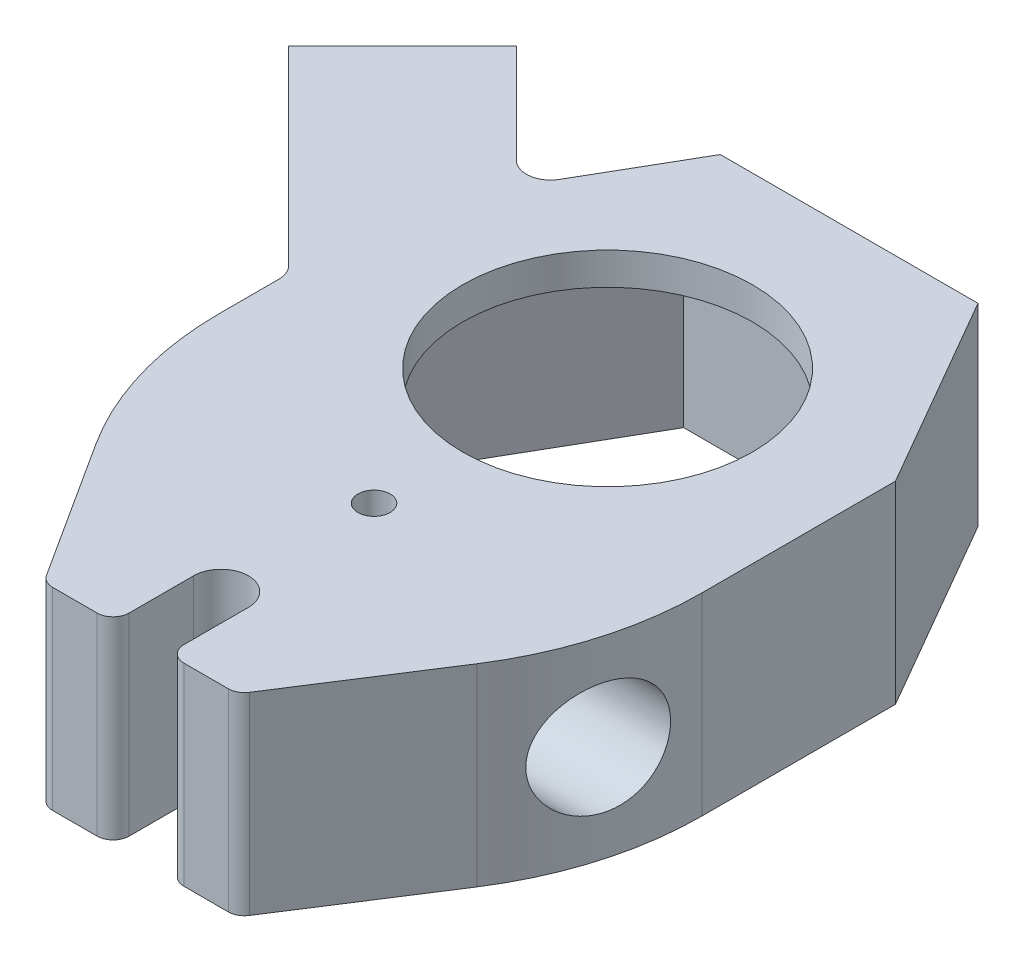
from build123d import *

# Parameters (mm, degrees)
SKETCH1_W           = 30
SKETCH1_H           = 30
BOSS_EXTRUDE1_DEPTH = 12
BOSS_EXTRUDE6_DEPTH = 12
CHAMFER1_SIZE       = 7
CHAMFER1_SIZE2      = 12.124355653
BOSS_EXTRUDE4_DEPTH = 12
SKETCH7_R           = 2.8
CUT_EXTRUDE2_DEPTH  = 15
CHAMFER2_SIZE       = 9
CHAMFER2_SIZE_2     = 14
CHAMFER3_SIZE       = 14
CHAMFER3_SIZE_2     = 9
FILLET2_R           = 20
FILLET3_R           = 1
FILLET4_R           = 1.5
SKETCH10_R          = 1
CUT_EXTRUDE3_DEPTH  = 42.546660516
SKETCH11_R          = 2
CUT_EXTRUDE4_DEPTH  = 42.546660516
SKETCH12_R          = 9
BOSS_EXTRUDE8_DEPTH = 2
SKETCH13_R          = 3.5
CUT_EXTRUDE5_DEPTH  = 8


with BuildPart() as part:
    # Sketch1 → Boss-Extrude1 (new body)
    with BuildSketch(Plane(origin=(0, 0, 0), x_dir=(1, 0, 0), z_dir=(0, 1, 0))):
        Rectangle(SKETCH1_W, SKETCH1_H)
        Polygon((6.452466608, -11.176), (12.904933217, 0), (6.452466608, 11.176), (-6.452466608, 11.176), (-12.904933217, 0), (-6.452466608, -11.176), align=None, mode=Mode.SUBTRACT)
    extrude(amount=BOSS_EXTRUDE1_DEPTH)

    # Sketch8 → Boss-Extrude6 (add)
    with BuildSketch(Plane(origin=(0, 0, 0), x_dir=(1, 0, 0), z_dir=(0, 1, 0))):
        with BuildLine():
            Line((-6, -15), (6, -15))
            Line((6, -15), (6, -29))
            Line((6, -29), (1.7, -29))
            Line((1.7, -29), (1.7, -24))
            ThreePointArc((1.7, -24), (0, -22.3), (-1.7, -24))
            Line((-1.7, -24), (-1.7, -29))
            Line((-1.7, -29), (-6, -29))
            Line((-6, -29), (-6, -15))
        make_face()
    extrude(amount=BOSS_EXTRUDE6_DEPTH)

    # Chamfer1
    chamfer1_edges = [part.edges().sort_by_distance(p)[0] for p in [
        (-15, 6, -15),
        (15, 6, -15),
    ]]
    chamfer1_side = [part.faces().sort_by_distance(p)[0] for p in [
        (0, 6, -15),
    ]]
    chamfer(chamfer1_edges, length=CHAMFER1_SIZE, length2=CHAMFER1_SIZE2, reference=chamfer1_side[0])

    # Sketch6 → Boss-Extrude4 (add)
    with BuildSketch(Plane(origin=(0, 0, 0), x_dir=(1, 0, 0), z_dir=(0, 1, 0))):
        Polygon((-27.223611076, 7.424621202), (-15, -4.798989873), (-15, 2.875644347), (-12.632730187, 6.975875938), (-20.152543264, 14.495689014), align=None)
    extrude(amount=BOSS_EXTRUDE4_DEPTH)

    # Sketch7 → Cut-Extrude2 (cut)
    with BuildSketch(Plane(origin=(-9.899494937, 0, 9.899494937), x_dir=(0.7071067811865438, 0, 0.7071067811865512), z_dir=(-0.7071067811865512, 0, 0.7071067811865438))):
        with Locations((-19.5, 6)):
            Circle(SKETCH7_R)
    extrude(amount=-CUT_EXTRUDE2_DEPTH, mode=Mode.SUBTRACT)

    # Chamfer2
    # the kernel refuses this chamfer: 14, 9 mm, written as the material it adds along each edge
    with BuildSketch(Plane(origin=(6, 0, 15), x_dir=(0.9987204462012896, 0, -0.05057143798130468), z_dir=(0, 1, 0))) as chamfer2_piece_1:
        Polygon((CHAMFER2_SIZE * 0.998720446201, -CHAMFER2_SIZE * 0.0505714379813), (-CHAMFER2_SIZE_2 * 0.0505714379813, -CHAMFER2_SIZE_2 * 0.998720446201), (0, 0), align=None)
    extrude(amount=12)

    # Chamfer3
    # the kernel refuses this chamfer: 14, 9 mm, written as the material it adds along each edge
    with BuildSketch(Plane(origin=(-6, 0, 15), x_dir=(0.020921616646829202, 0, 0.9997811190240007), z_dir=(0, 1, 0))) as chamfer3_piece_1:
        Polygon((CHAMFER3_SIZE * 0.999781119024, -CHAMFER3_SIZE * 0.0209216166468), (-CHAMFER3_SIZE_2 * 0.0209216166468, -CHAMFER3_SIZE_2 * 0.999781119024), (0, 0), align=None)
    extrude(amount=12)

    # Fillet2
    fillet2_edges = [part.edges().sort_by_distance(p)[0] for p in [
        (15, 6, 15),
        (-15, 6, 15),
    ]]
    fillet(fillet2_edges, radius=FILLET2_R)

    # Fillet3
    fillet3_edges = [part.edges().sort_by_distance(p)[0] for p in [
        (-6, 6, 29),
        (-1.7, 6, 29),
        (1.7, 6, 29),
        (6, 6, 29),
    ]]
    fillet(fillet3_edges, radius=FILLET3_R)

    # Fillet4
    fillet4_edges = [part.edges().sort_by_distance(p)[0] for p in [
        (-15, 6, 4.798989873),
        (-12.632730187, 6, -6.975875938),
    ]]
    fillet(fillet4_edges, radius=FILLET4_R)

    # Sketch10 → Cut-Extrude3 (cut, through all)
    with BuildSketch(Plane(origin=(0, 12, 0), x_dir=(1, 0, 0), z_dir=(0, 1, 0))):
        with Locations(Location((0, -14.5, 0), (0, 0, 270))):
            Circle(SKETCH10_R)
    extrude(amount=-CUT_EXTRUDE3_DEPTH, mode=Mode.SUBTRACT)

    # Sketch11 → Cut-Extrude4 (cut, through all)
    with BuildSketch(Plane(origin=(0, 0, 0), x_dir=(0, 0, -1), z_dir=(1, 0, 0))):
        with Locations(Location((-14.5, 6, 0), (0, 0, 180))):
            Circle(SKETCH11_R)
    extrude(amount=CUT_EXTRUDE4_DEPTH, mode=Mode.SUBTRACT)

    # Sketch12 → Boss-Extrude8 (add)
    with BuildSketch(Plane(origin=(0, 12, 0), x_dir=(1, 0, 0), z_dir=(0, 1, 0))):
        Polygon((6.452466608, 11.176), (-6.452466608, 11.176), (-12.904933217, 0), (-6.452466608, -11.176), (6.452466608, -11.176), (12.904933217, 0), align=None)
        with Locations(Location((0, 0, 0), (0, 0, 270))):
            Circle(SKETCH12_R, mode=Mode.SUBTRACT)
    extrude(amount=-BOSS_EXTRUDE8_DEPTH)

    # Sketch13 → Cut-Extrude5 (cut)
    with BuildSketch(Plane(origin=(15, 0, 0), x_dir=(0, 0, -1), z_dir=(1, 0, 0))):
        with Locations((-14.5, 6)):
            Circle(SKETCH13_R)
    extrude(amount=-CUT_EXTRUDE5_DEPTH, mode=Mode.SUBTRACT)


solid = part.part
